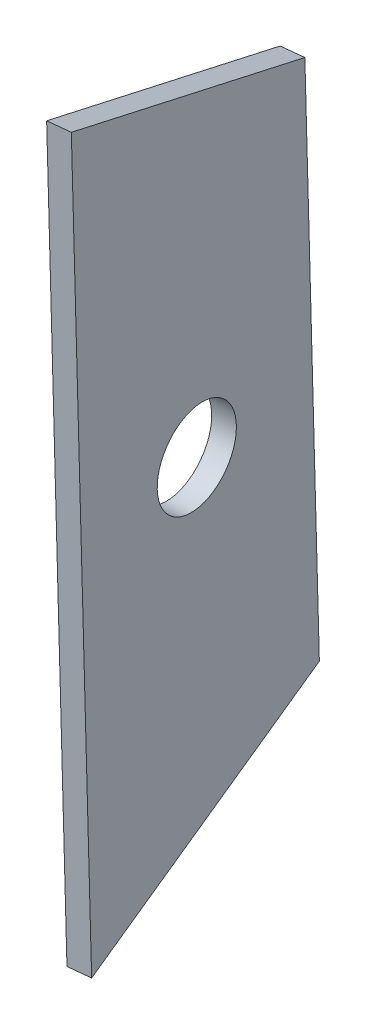
from build123d import *

# Parameters (mm, degrees)
SKETCH1_R           = 3.2639
BOSS_EXTRUDE1_DEPTH = 1.5875


with BuildPart() as part:
    # Sketch1 → Boss-Extrude1 (new body)
    with BuildSketch(Plane(origin=(368.936903679, -5.383850256, -45.587186199), x_dir=(-0.12260510858720207, 0.001789161069619477, -0.9924539214749405), z_dir=(0.9923482658198145, -0.014481214569019532, -0.12261816239453538))):
        Polygon((411.594066589, 245.557996517), (414.180881556, 191.185032904), (432.797343041, 200.517860894), (430.950777657, 239.331318274), align=None)
        with Locations((422.380767211, 219.148052147)):
            Circle(SKETCH1_R, mode=Mode.SUBTRACT)
    extrude(amount=BOSS_EXTRUDE1_DEPTH)


solid = part.part
